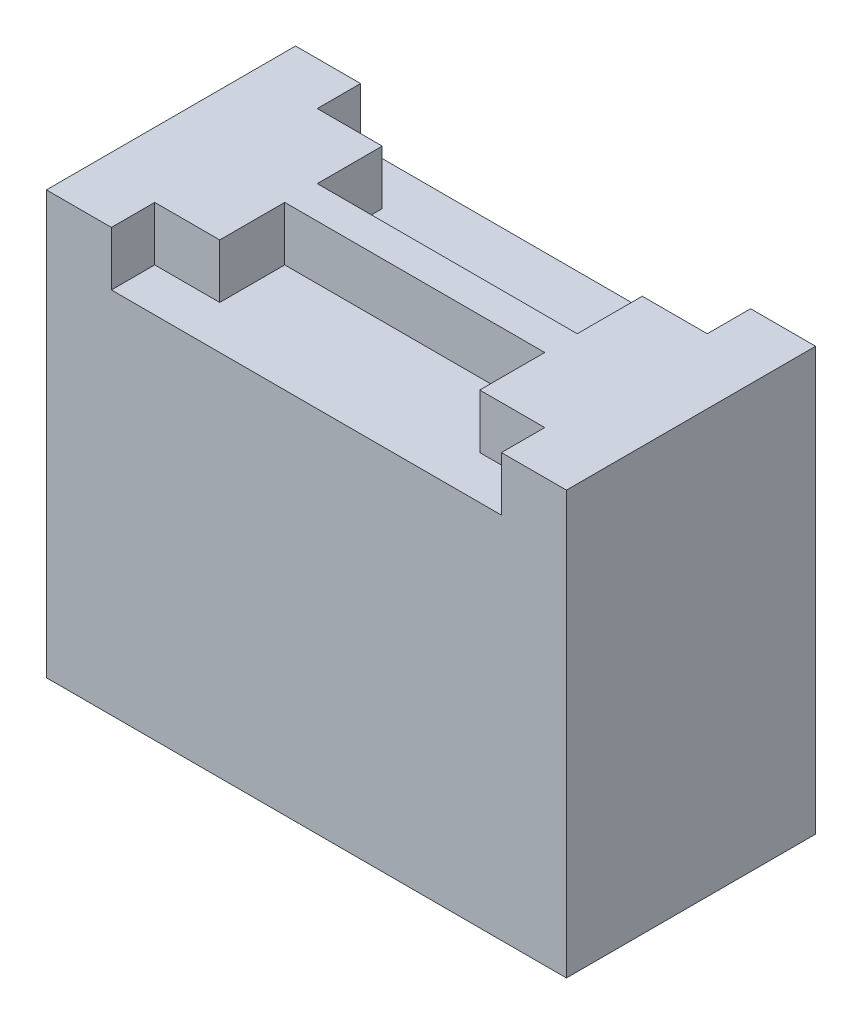
from build123d import *

# Parameters (mm, degrees)
SKETCH_1_W               = 240
SKETCH_1_H               = 195
EXTRUDE_1_DEPTH          = 57.5
CUT_EXTRUDE_1_DEPTH      = 165.962116863
CUT_EXTRUDE_1_DEPTH_BACK = 50
CUT_EXTRUDE_START        = -20
CUT_EXTRUDE_2_OUTLINE_W  = 30
CUT_EXTRUDE_2_OUTLINE_H  = 25
CUT_EXTRUDE_2_DEPTH      = 20


# Read off the part's stored shape, not the designer's step: 切除-拉伸2
with BuildPart() as part:
    # 草图1 → 凸台-拉伸1 (new body)
    with BuildSketch(Plane.XY):
        Rectangle(SKETCH_1_W, SKETCH_1_H)
    extrude(amount=EXTRUDE_1_DEPTH)

    # 草图2 → 切除-拉伸1 (cut, two sides: drawn at the far end of the back side and taken through both)
    with BuildSketch(Plane.XY.offset(57.5).offset(-CUT_EXTRUDE_1_DEPTH_BACK)):
        Polygon((-60, 638.254180389), (-60, 97.5), (-60, 72.5), (60, 72.5), (60, 97.5), (60, 638.254180389), (60, 1719.762541166), (-60, 1719.762541166), align=None)
    extrude(amount=CUT_EXTRUDE_1_DEPTH + CUT_EXTRUDE_1_DEPTH_BACK, mode=Mode.SUBTRACT)

    # 切除-拉伸2 outline → 切除-拉伸2 (cut)
    with BuildSketch(Plane.XY.offset(57.5).offset(CUT_EXTRUDE_START)):
        with Locations((-75, 85)):
            Rectangle(CUT_EXTRUDE_2_OUTLINE_W, CUT_EXTRUDE_2_OUTLINE_H)
    cut_extrude_2 = extrude(amount=CUT_EXTRUDE_2_DEPTH, mode=Mode.SUBTRACT)

    # 镜向1: 切除-拉伸2 across plane
    add(cut_extrude_2.mirror(Plane(origin=(0, 0, 0), x_dir=(0, 0, 1), z_dir=(1, 0, 0))), mode=Mode.SUBTRACT)

    # 镜向2: part across plane


with BuildPart() as part_1:
    add(part.part)
    add(part.part.mirror(Plane(origin=(0, 0, 0), x_dir=(1, 0, 0), z_dir=(0, 0, -1))))


solid = part_1.part
